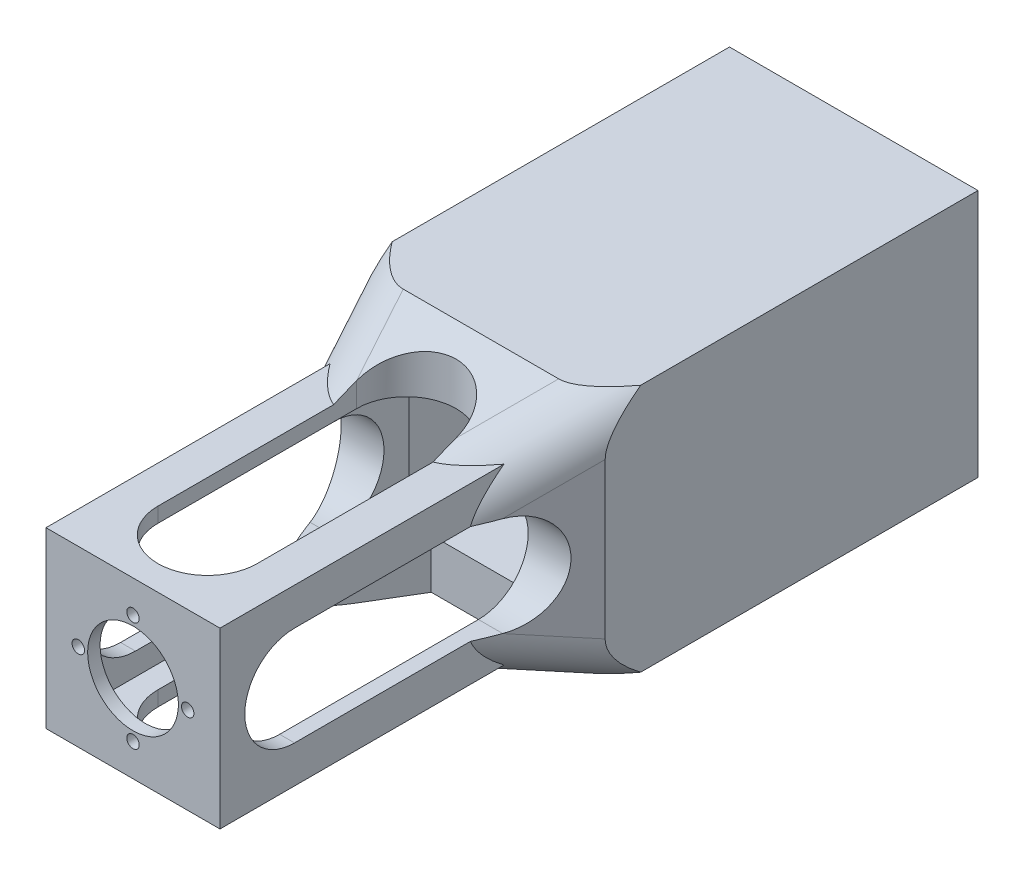
from build123d import *

# Parameters (mm, degrees)
IZIM1_W                     = 35
IZIM1_H                     = 35
IZIM1_W_2                   = 29
IZIM1_H_2                   = 29
Y_KSEKLIK_EKSTR_ZYON1_DEPTH = 35
IZIM2_W                     = 35
IZIM2_H                     = 35
Y_KSEKLIK_EKSTR_ZYON2_DEPTH = 2.5
IZIM7_R                     = 1.25
KES_EKSTR_ZYON5_DEPTH       = 75.246212025
IZIM5_R                     = 9.125
KES_EKSTR_ZYON3_DEPTH       = 72.894019223
IZIM10_W                    = 50
IZIM10_H                    = 50
IZIM10_W_2                  = 30.1
IZIM10_H_2                  = 30.1
Y_KSEKLIK_EKSTR_ZYON3_DEPTH = 75
IZIM12_W                    = 50
IZIM12_H                    = 50
IZIM12_W_2                  = 35
IZIM12_H_2                  = 35
Y_KSEKLIK_EKSTR_ZYON4_DEPTH = 20
KES_EKSTR_ZYON1_DEPTH       = 121.545634512
KES_EKSTR_ZYON6_START       = -10
KES_EKSTR_ZYON6_DEPTH       = 10
DAIRESEL_KAPLAMA1_COUNT     = 4
KES_EKSTR_ZYON7_DEPTH       = 124.389626793
KES_EKSTR_ZYON8_DEPTH       = 124.389626793
RADYUS4_R                   = 10
KES_EKSTR_ZYON9_DEPTH       = 121.545634512


with BuildPart() as part:
    # Çizim1 → Yükseklik-Ekstrüzyon1 (new, symmetric)
    with BuildSketch(Plane.XY):
        Rectangle(IZIM1_W, IZIM1_H)
        Rectangle(IZIM1_W_2, IZIM1_H_2, mode=Mode.SUBTRACT)
    extrude(amount=Y_KSEKLIK_EKSTR_ZYON1_DEPTH, both=True)

    # Çizim2 → Yükseklik-Ekstrüzyon2 (add)
    with BuildSketch(Plane.XY.offset(35)):
        Rectangle(IZIM2_W, IZIM2_H)
    extrude(amount=-Y_KSEKLIK_EKSTR_ZYON2_DEPTH)

    # Çizim7 → Kes-Ekstrüzyon5 (cut, through all)
    with BuildSketch(Plane.XY.offset(35)):
        with Locations((-11, 0)):
            Circle(IZIM7_R)
        with Locations((11, 0)):
            Circle(IZIM7_R)
        with Locations((0, 11)):
            Circle(IZIM7_R)
        with Locations((0, -11)):
            Circle(IZIM7_R)
    extrude(amount=-KES_EKSTR_ZYON5_DEPTH, mode=Mode.SUBTRACT)

    # Çizim5 → Kes-Ekstrüzyon3 (cut, through all)
    with BuildSketch(Plane(origin=(0, 0, 32.5), x_dir=(-1, 0, 0), z_dir=(0, 0, -1))):
        Circle(IZIM5_R)
    extrude(amount=-KES_EKSTR_ZYON3_DEPTH, mode=Mode.SUBTRACT)



with BuildPart() as body_2:
    # Çizim10 → Yükseklik-Ekstrüzyon3 (new body)
    with BuildSketch(Plane(origin=(0, 0, -35), x_dir=(-1, 0, 0), z_dir=(0, 0, -1))):
        Rectangle(IZIM10_W, IZIM10_H)
        Rectangle(IZIM10_W_2, IZIM10_H_2, mode=Mode.SUBTRACT)
    extrude(amount=Y_KSEKLIK_EKSTR_ZYON3_DEPTH)


with BuildPart() as part_1:
    add(part.part)

    add(body_2.part)  # Yükseklik-Ekstrüzyon4 merges body 2
    # Çizim12 → Yükseklik-Ekstrüzyon4 (add)
    with BuildSketch(Plane.XY.offset(-35)):
        Rectangle(IZIM12_W, IZIM12_H)
        Rectangle(IZIM12_W_2, IZIM12_H_2, mode=Mode.SUBTRACT)
    extrude(amount=Y_KSEKLIK_EKSTR_ZYON4_DEPTH)

    # Çizim3 → Kes-Ekstrüzyon1 (cut, through all)
    with BuildSketch(Plane(origin=(0, 17.5, 0), x_dir=(1, 0, 0), z_dir=(0, 1, 0))):
        with BuildLine():
            Line((10, 20), (10, -20))
            ThreePointArc((10, -20), (0, -30), (-10, -20))
            Line((-10, -20), (-10, 20))
            ThreePointArc((-10, 20), (0, 30), (10, 20))
        make_face()
    kes_ekstr_zyon1 = extrude(amount=-KES_EKSTR_ZYON1_DEPTH, mode=Mode.SUBTRACT)

    # Çizim8 → Kes-Ekstrüzyon6 (cut)
    with BuildSketch(Plane.XZ.offset(17.5).offset(KES_EKSTR_ZYON6_START)):
        with BuildLine():
            Line((-10, -20), (-10, -35))
            Line((-10, -35), (10, -35))
            Line((10, -35), (10, -20))
            ThreePointArc((10, -20), (0, -30), (-10, -20))
        make_face()
    extrude(amount=KES_EKSTR_ZYON6_DEPTH, mode=Mode.SUBTRACT)

    # Dairesel Kaplama1: Kes-Ekstrüzyon1 ×4 about axis
    dairesel_kaplama1_axis = Axis((0, 0, 0), (0, 0, 1))
    for i in range(1, DAIRESEL_KAPLAMA1_COUNT):
        add(kes_ekstr_zyon1.rotate(dairesel_kaplama1_axis, i * 360 / DAIRESEL_KAPLAMA1_COUNT), mode=Mode.SUBTRACT)

    # Çizim13 → Kes-Ekstrüzyon7 (cut, through all)
    with BuildSketch(Plane(origin=(25, 0, 0), x_dir=(0, 0, -1), z_dir=(1, 0, 0))):
        Polygon((15, 25), (15, 17.5), (35, 25), align=None)
        Polygon((15, -17.5), (15, -25), (35, -25), align=None)
    extrude(amount=-KES_EKSTR_ZYON7_DEPTH, mode=Mode.SUBTRACT)

    # Çizim14 → Kes-Ekstrüzyon8 (cut, through all)
    with BuildSketch(Plane.XZ.offset(25)):
        Polygon((-17.5, -15), (-25, -35), (-25, -15), align=None)
        Polygon((17.5, -15), (25, -15), (25, -35), align=None)
    extrude(amount=-KES_EKSTR_ZYON8_DEPTH, mode=Mode.SUBTRACT)

    # Radyus4
    # the kernel refuses this fillet: 10 mm, written as the material it takes off along each edge
    with BuildSketch(Plane(origin=(32.317073171, 32.317073171, -54.512195122), x_dir=(-0.9435273723846194, 0.11632529248577513, -0.31020077996206696), z_dir=(-0.33129457822453995, -0.3312945782245377, 0.883452208598773))) as radyus4_piece_1_section:
        with BuildLine():
            CenterArc((RADYUS4_R * 0.883452208599, RADYUS4_R), RADYUS4_R, 187.08188169, 82.91811831)
            Line((-RADYUS4_R * 0.108918765444, RADYUS4_R * 0.876712328767), (0, 0))
            Line((0, 0), (RADYUS4_R * 0.883452208599, 0))
        make_face()
    radyus4_piece_1 = extrude(amount=66.811073275, mode=Mode.PRIVATE)
    radyus4_piece_1 = split(radyus4_piece_1, bisect_by=Plane(origin=(17.5, 21.25, -29.89398757), z_dir=(1, 0, 0)), keep=Keep.TOP, mode=Mode.PRIVATE)
    add(radyus4_piece_1, mode=Mode.SUBTRACT)
    with BuildSketch(Plane(origin=(32.317073171, 32.317073171, -54.512195122), x_dir=(-0.9435273723846194, 0.11632529248577513, -0.31020077996206696), z_dir=(-0.33129457822453995, -0.3312945782245377, 0.883452208598773))) as radyus4_piece_2_section:
        with BuildLine():
            CenterArc((RADYUS4_R * 0.883452208599, RADYUS4_R), RADYUS4_R, 187.08188169, 82.91811831)
            Line((-RADYUS4_R * 0.108918765444, RADYUS4_R * 0.876712328767), (0, 0))
            Line((0, 0), (RADYUS4_R * 0.883452208599, 0))
        make_face()
    radyus4_piece_2 = extrude(amount=66.811073275, mode=Mode.PRIVATE)
    radyus4_piece_2 = split(radyus4_piece_2, bisect_by=Plane(origin=(16.256655696, 17.5, -22.379324277), z_dir=(0, 1, 0)), keep=Keep.TOP, mode=Mode.PRIVATE)
    add(radyus4_piece_2, mode=Mode.SUBTRACT)
    with BuildSketch(Plane(origin=(-10.182926829, 10.182926829, 4.512195122), x_dir=(0.943527372384614, 0.11632529248577986, -0.3102007799620813), z_dir=(-0.33129457822455505, 0.3312945782245359, -0.883452208598768))) as radyus4_piece_3_section:
        with BuildLine():
            CenterArc((RADYUS4_R * 0.883452208599, RADYUS4_R), RADYUS4_R, 187.08188169, 82.91811831)
            Line((-RADYUS4_R * 0.108918765444, RADYUS4_R * 0.876712328767), (0, 0))
            Line((0, 0), (RADYUS4_R * 0.883452208599, 0))
        make_face()
    radyus4_piece_3 = extrude(amount=66.811073275, mode=Mode.PRIVATE)
    radyus4_piece_3 = split(radyus4_piece_3, bisect_by=Plane(origin=(-17.5, 13.216664443, -19.287647888), z_dir=(-1, 0, 0)), keep=Keep.TOP, mode=Mode.PRIVATE)
    add(radyus4_piece_3, mode=Mode.SUBTRACT)
    with BuildSketch(Plane(origin=(-10.182926829, 10.182926829, 4.512195122), x_dir=(0.943527372384614, 0.11632529248577986, -0.3102007799620813), z_dir=(-0.33129457822455505, 0.3312945782245359, -0.883452208598768))) as radyus4_piece_4_section:
        with BuildLine():
            CenterArc((RADYUS4_R * 0.883452208599, RADYUS4_R), RADYUS4_R, 187.08188169, 82.91811831)
            Line((-RADYUS4_R * 0.108918765444, RADYUS4_R * 0.876712328767), (0, 0))
            Line((0, 0), (RADYUS4_R * 0.883452208599, 0))
        make_face()
    radyus4_piece_4 = extrude(amount=66.811073275, mode=Mode.PRIVATE)
    radyus4_piece_4 = split(radyus4_piece_4, bisect_by=Plane(origin=(-13.216664444, 17.5, -19.287647888), z_dir=(0, 1, 0)), keep=Keep.TOP, mode=Mode.PRIVATE)
    add(radyus4_piece_4, mode=Mode.SUBTRACT)
    with BuildSketch(Plane(origin=(10.182926829, -10.182926829, 4.512195122), x_dir=(0.11632529248577561, 0.9435273723846188, -0.3102007799620686), z_dir=(0.33129457822453945, -0.3312945782245416, -0.8834522085987717))) as radyus4_piece_5_section:
        with BuildLine():
            CenterArc((RADYUS4_R * 0.883452208599, -RADYUS4_R), RADYUS4_R, 90, 82.91811831)
            Line((-RADYUS4_R * 0.108918765444, -RADYUS4_R * 0.876712328767), (0, 0))
            Line((0, 0), (RADYUS4_R * 0.883452208599, 0))
        make_face()
    radyus4_piece_5 = extrude(amount=66.811073275, mode=Mode.PRIVATE)
    radyus4_piece_5 = split(radyus4_piece_5, bisect_by=Plane(origin=(13.216664443, -17.5, -19.287647888), z_dir=(0, -1, 0)), keep=Keep.TOP, mode=Mode.PRIVATE)
    add(radyus4_piece_5, mode=Mode.SUBTRACT)
    with BuildSketch(Plane(origin=(10.182926829, -10.182926829, 4.512195122), x_dir=(0.11632529248577561, 0.9435273723846188, -0.3102007799620686), z_dir=(0.33129457822453945, -0.3312945782245416, -0.8834522085987717))) as radyus4_piece_6_section:
        with BuildLine():
            CenterArc((RADYUS4_R * 0.883452208599, -RADYUS4_R), RADYUS4_R, 90, 82.91811831)
            Line((-RADYUS4_R * 0.108918765444, -RADYUS4_R * 0.876712328767), (0, 0))
            Line((0, 0), (RADYUS4_R * 0.883452208599, 0))
        make_face()
    radyus4_piece_6 = extrude(amount=66.811073275, mode=Mode.PRIVATE)
    radyus4_piece_6 = split(radyus4_piece_6, bisect_by=Plane(origin=(17.5, -13.216664444, -19.287647888), z_dir=(1, 0, 0)), keep=Keep.TOP, mode=Mode.PRIVATE)
    add(radyus4_piece_6, mode=Mode.SUBTRACT)
    with BuildSketch(Plane(origin=(-32.317073171, -32.317073171, -54.512195122), x_dir=(-0.11632529248578077, 0.9435273723846194, -0.31020077996206435), z_dir=(0.33129457822455455, 0.33129457822453956, 0.8834522085987668))) as radyus4_piece_7_section:
        with BuildLine():
            CenterArc((RADYUS4_R * 0.883452208599, -RADYUS4_R), RADYUS4_R, 90, 82.91811831)
            Line((-RADYUS4_R * 0.108918765444, -RADYUS4_R * 0.876712328767), (0, 0))
            Line((0, 0), (RADYUS4_R * 0.883452208599, 0))
        make_face()
    radyus4_piece_7 = extrude(amount=66.811073275, mode=Mode.PRIVATE)
    radyus4_piece_7 = split(radyus4_piece_7, bisect_by=Plane(origin=(-21.25, -17.5, -29.89398757), z_dir=(0, -1, 0)), keep=Keep.TOP, mode=Mode.PRIVATE)
    add(radyus4_piece_7, mode=Mode.SUBTRACT)
    with BuildSketch(Plane(origin=(-32.317073171, -32.317073171, -54.512195122), x_dir=(-0.11632529248578077, 0.9435273723846194, -0.31020077996206435), z_dir=(0.33129457822455455, 0.33129457822453956, 0.8834522085987668))) as radyus4_piece_8_section:
        with BuildLine():
            CenterArc((RADYUS4_R * 0.883452208599, -RADYUS4_R), RADYUS4_R, 90, 82.91811831)
            Line((-RADYUS4_R * 0.108918765444, -RADYUS4_R * 0.876712328767), (0, 0))
            Line((0, 0), (RADYUS4_R * 0.883452208599, 0))
        make_face()
    radyus4_piece_8 = extrude(amount=66.811073275, mode=Mode.PRIVATE)
    radyus4_piece_8 = split(radyus4_piece_8, bisect_by=Plane(origin=(-17.5, -16.256655696, -22.379324277), z_dir=(-1, 0, 0)), keep=Keep.TOP, mode=Mode.PRIVATE)
    add(radyus4_piece_8, mode=Mode.SUBTRACT)

    # Çizim15 → Kes-Ekstrüzyon9 (cut, through all)
    with BuildSketch(Plane(origin=(0, -17.5, 0), x_dir=(1, 0, 0), z_dir=(0, 1, 0))):
        with BuildLine():
            Line((10, 20), (10, 35))
            Line((10, 35), (-10, 35))
            Line((-10, 35), (-10, 20))
            ThreePointArc((-10, 20), (0, 30), (10, 20))
        make_face()
    extrude(amount=-KES_EKSTR_ZYON9_DEPTH, mode=Mode.SUBTRACT)


solid = part_1.part
